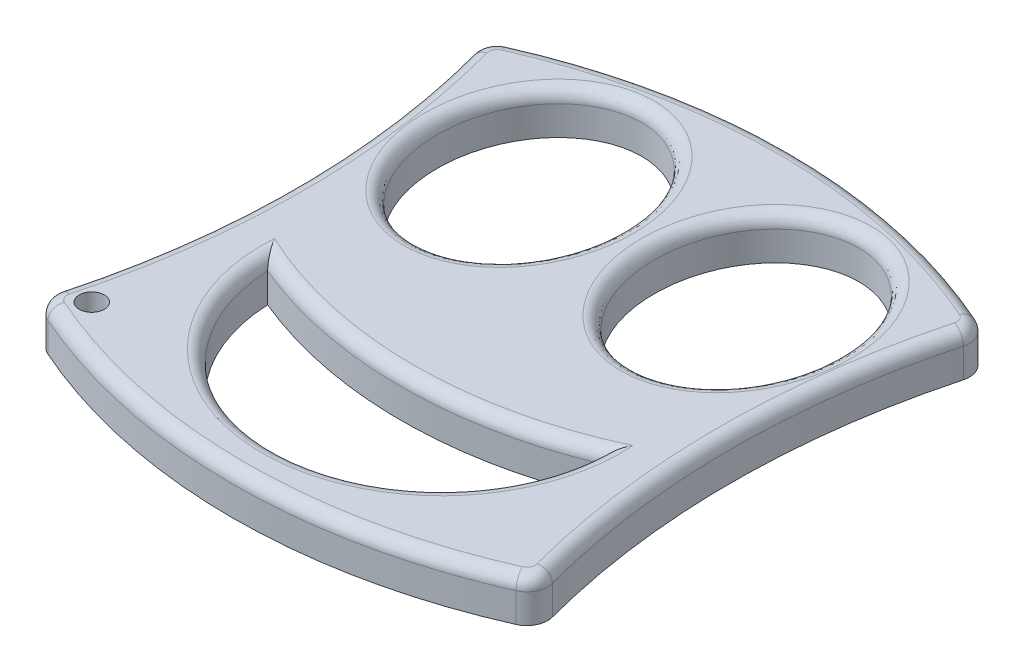
from build123d import *

# Parameters (mm, degrees)
SCHIZZO1_R                   = 1.5
SCHIZZO1_RX                  = 13.5
SCHIZZO1_RY                  = 11
ESTRUSIONE_ESTRUSIONE1_DEPTH = 5
RACCORDO1_R                  = 1.5
RACCORDO3_START              = -1
RACCORDO3_DEPTH              = 7
RACCORDO3_2_ANGLE            = 81.075888
RACCORDO3_3_ANGLE            = 81.075888
RACCORDO3_4_ANGLE            = 81.075888
RACCORDO3_5_ANGLE            = 81.075888


with BuildPart() as part:
    # Schizzo1 → Estrusione-Estrusione1 (new body)
    with BuildSketch(Plane(origin=(0, 0, 0), x_dir=(1, 0, 0), z_dir=(0, 1, 0))):
        with BuildLine():
            ThreePointArc((-30, 24.06625725), (0, 30.903282015), (30, 24.06625725))
            ThreePointArc((30, 24.06625725), (26.205041341, -2.562032416), (30, -29.190322083))
            ThreePointArc((30, -29.190322083), (0, -36.027346848), (-30, -29.190322083))
            ThreePointArc((-30, -29.190322083), (-26.205041341, -2.562032416), (-30, 24.06625725))
        make_face()
        with Locations(Location((-25.814738983, -27.071033032, 0), (0, 0, 90))):
            Circle(SCHIZZO1_R, mode=Mode.SUBTRACT)
        with Locations(Location((-13, 12.472653152), (0, 0, 90))):
            Ellipse(SCHIZZO1_RX, SCHIZZO1_RY, mode=Mode.SUBTRACT)
        with Locations(Location((13, 12.472653152), (0, 0, 90))):
            Ellipse(SCHIZZO1_RX, SCHIZZO1_RY, mode=Mode.SUBTRACT)
        with BuildLine():
            ThreePointArc((-20, -11.828617148), (0, -15.828617148), (20, -11.828617148))
            ThreePointArc((20, -11.828617148), (0, -31.027346848), (-20, -11.828617148))
        make_face(mode=Mode.SUBTRACT)
    extrude(amount=ESTRUSIONE_ESTRUSIONE1_DEPTH)

    # Raccordo1
    raccordo1_edges = [part.edges().sort_by_distance(p)[0] for p in [
        (-26.205041341, 5, 2.562032416),
        (13.001315842, 5, 1.027346751),
        (0, 5, 36.027346848),
        (-12.998684158, 5, 1.027346751),
        (0, 5, 31.027346848),
        (0, 5, 15.828617148),
        (26.205041341, 5, 2.562032416),
        (0, 5, -30.903282015),
    ]]
    fillet(raccordo1_edges, radius=RACCORDO1_R)

    # Raccordo3: read off the stored shape, not the designer's step
    # Raccordo3 outline → Raccordo3 (cut)
    with BuildSketch(Plane(origin=(0, 0, 0), x_dir=(1, 0, 0), z_dir=(0, 1, 0)).offset(RACCORDO3_START)):
        with BuildLine():
            ThreePointArc((-29.435535694, 22.043301517), (-29.275250164, 23.768007937), (-28.032461563, 24.974565097))
            ThreePointArc((-28.032461563, 24.974565097), (-29.019784709, 24.528109542), (-30, 24.06625725))
            ThreePointArc((-30, 24.06625725), (-29.712196058, 23.056334077), (-29.435535694, 22.043301517))
        make_face()
        with BuildLine():
            ThreePointArc((30, 24.06625725), (29.019784709, 24.528109542), (28.032461563, 24.974565097))
            ThreePointArc((28.032461563, 24.974565097), (29.275250164, 23.768007937), (29.435535694, 22.043301517))
            ThreePointArc((29.435535694, 22.043301517), (29.712196058, 23.056334077), (30, 24.06625725))
        make_face()
        with BuildLine():
            ThreePointArc((-28.032461563, -30.09862993), (-29.275250164, -28.89207277), (-29.435535694, -27.16736635))
            ThreePointArc((-29.435535694, -27.16736635), (-29.712196058, -28.18039891), (-30, -29.190322083))
            ThreePointArc((-30, -29.190322083), (-29.019784709, -29.652174375), (-28.032461563, -30.09862993))
        make_face()
        with BuildLine():
            ThreePointArc((30, -29.190322083), (29.712196058, -28.18039891), (29.435535694, -27.16736635))
            ThreePointArc((29.435535694, -27.16736635), (29.275250164, -28.89207277), (28.032461563, -30.09862993))
            ThreePointArc((28.032461563, -30.09862993), (29.019784709, -29.652174375), (30, -29.190322083))
        make_face()
    extrude(amount=RACCORDO3_DEPTH, mode=Mode.SUBTRACT)

    # Raccordo3 2 outline → Raccordo3 2 (revolve, cut)
    with BuildSketch(Plane(origin=(-27.020263703, 0, -22.688639575), x_dir=(-0.4048791441074497, 0, -0.9143702087594603), z_dir=(0.9143702087594603, 0, -0.4048791441074497))):
        with BuildLine():
            ThreePointArc((1, 5), (2.060660172, 4.560660172), (2.5, 3.5))
            Line((2.5, 3.5), (2.5, 5))
            Line((2.5, 5), (1, 5))
        make_face()
    revolve(axis=Axis((-27.020263703, 0, -22.688639575), (0, 1, 0)), revolution_arc=RACCORDO3_2_ANGLE, mode=Mode.SUBTRACT)

    # Raccordo3 3 outline → Raccordo3 3 (revolve, cut)
    with BuildSketch(Plane(origin=(27.020263703, 0, -22.688639575), x_dir=(0.9661087964600781, 0, 0.2581352230952981), z_dir=(-0.2581352230952981, 0, 0.9661087964600781))):
        with BuildLine():
            ThreePointArc((1, 5), (2.060660172, 4.560660172), (2.5, 3.5))
            Line((2.5, 3.5), (2.5, 5))
            Line((2.5, 5), (1, 5))
        make_face()
    revolve(axis=Axis((27.020263703, 0, -22.688639575), (0, 1, 0)), revolution_arc=RACCORDO3_3_ANGLE, mode=Mode.SUBTRACT)

    # Raccordo3 4 outline → Raccordo3 4 (revolve, cut)
    with BuildSketch(Plane(origin=(27.020263703, 0, 27.812704408), x_dir=(0.4048791441074346, 0, 0.914370208759467), z_dir=(-0.914370208759467, 0, 0.4048791441074346))):
        with BuildLine():
            ThreePointArc((1, 5), (2.060660172, 4.560660172), (2.5, 3.5))
            Line((2.5, 3.5), (2.5, 5))
            Line((2.5, 5), (1, 5))
        make_face()
    revolve(axis=Axis((27.020263703, 0, 27.812704408), (0, 1, 0)), revolution_arc=RACCORDO3_4_ANGLE, mode=Mode.SUBTRACT)

    # Raccordo3 5 outline → Raccordo3 5 (revolve, cut)
    with BuildSketch(Plane(origin=(-27.020263703, 0, 27.812704408), x_dir=(-0.9661087964600926, 0, -0.2581352230952439), z_dir=(0.2581352230952439, 0, -0.9661087964600926))):
        with BuildLine():
            ThreePointArc((1, 5), (2.060660172, 4.560660172), (2.5, 3.5))
            Line((2.5, 3.5), (2.5, 5))
            Line((2.5, 5), (1, 5))
        make_face()
    revolve(axis=Axis((-27.020263703, 0, 27.812704408), (0, 1, 0)), revolution_arc=RACCORDO3_5_ANGLE, mode=Mode.SUBTRACT)


solid = part.part
